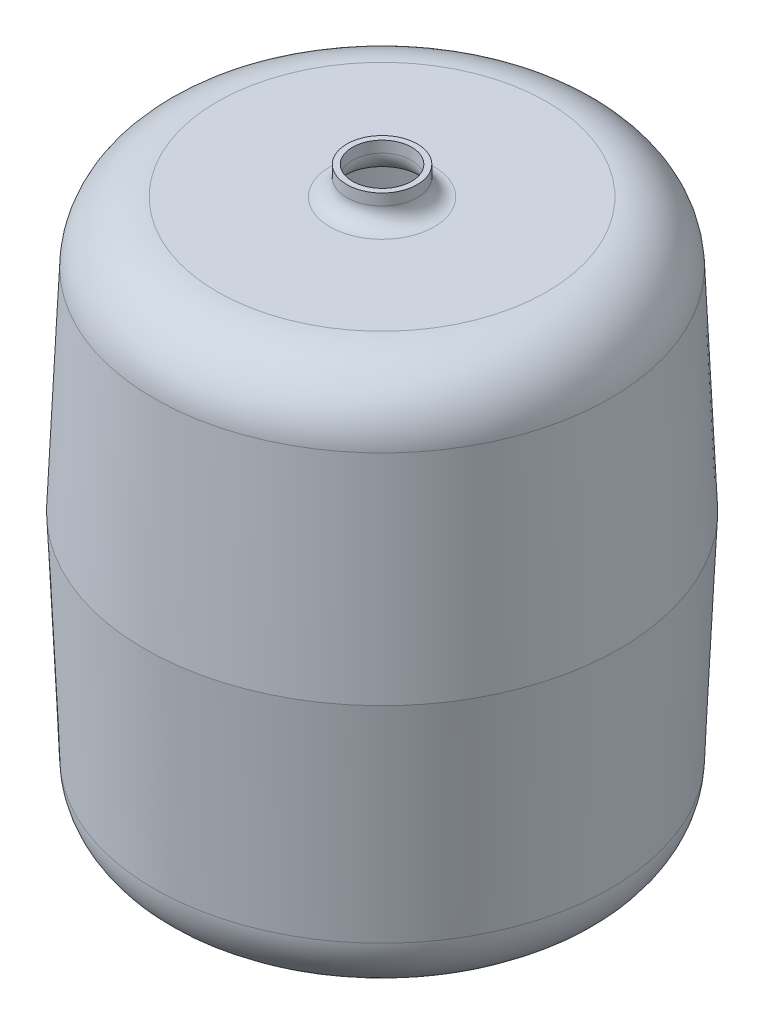
from build123d import *

# Parameters (mm, degrees)
CUT_EXTRUDE1_START = -30
SKETCH3_R          = 21
CUT_EXTRUDE1_DEPTH = 30


with BuildPart() as part:
    # Sketch1 → Revolve1 (revolve)
    with BuildSketch(Plane.XY):
        with BuildLine():
            Line((0, 0), (116.921871599, 0))
            ThreePointArc((116.921871599, 0), (148.039959109, 12.493621707), (161.87904157, 43.037127569))
            Line((161.87904157, 43.037127569), (168.459307689, 193.75))
            Line((168.459307689, 193.75), (161.87904157, 344.462872431))
            ThreePointArc((161.87904157, 344.462872431), (148.039959109, 375.006378293), (116.921871599, 387.5))
            Line((116.921871599, 387.5), (37, 387.5))
            ThreePointArc((37, 387.5), (28.514718626, 391.014718626), (25, 399.5))
            Line((25, 399.5), (25, 407.5))
            Line((25, 407.5), (0, 407.5))
            Line((0, 407.5), (0, 403.5))
            Line((0, 403.5), (21, 403.5))
            Line((21, 403.5), (21, 399.5))
            ThreePointArc((21, 399.5), (25.686291501, 388.186291501), (37, 383.5))
            Line((37, 383.5), (116.921871599, 383.5))
            ThreePointArc((116.921871599, 383.5), (145.273906886, 372.116922444), (157.882848683, 344.288394882))
            Line((157.882848683, 344.288394882), (164.455496948, 193.75))
            Line((164.455496948, 193.75), (157.882848683, 43.211605118))
            ThreePointArc((157.882848683, 43.211605118), (145.273906886, 15.383077556), (116.921871599, 4))
            Line((116.921871599, 4), (0, 4))
            Line((0, 4), (0, 0))
        make_face()
    revolve(axis=Axis((0, 579.019102, 0), (0, -1, 0)))

    # Sketch3 → Cut-Extrude1 (cut)
    with BuildSketch(Plane(origin=(0, 407.5, 0), x_dir=(1, 0, 0), z_dir=(0, 1, 0)).offset(CUT_EXTRUDE1_START)):
        Circle(SKETCH3_R)
    extrude(amount=CUT_EXTRUDE1_DEPTH, mode=Mode.SUBTRACT)


solid = part.part
